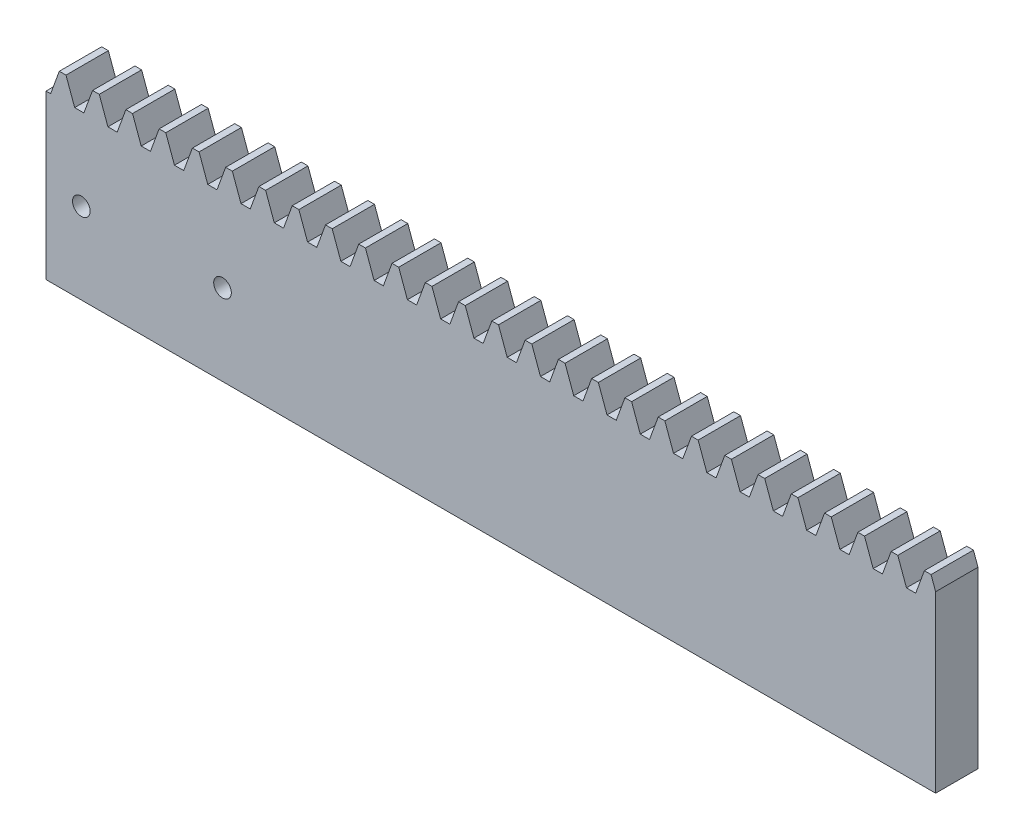
from build123d import *

# Parameters (mm, degrees)
BLANKSKE_W              = 126
BLANKSKE_H              = 26.5
BLANK_DEPTH             = 6
TOOTHCUTSIM_DEPTH       = 129.896276129
TEETHCUTS_COUNT         = 33
TEETHCUTS_PITCH         = 4.712388975
ESQUISSE1_R             = 1.25
ENL_V_MAT_EXTRU_1_DEPTH = 6


with BuildPart() as part:
    # BlankSke → Blank (new body)
    with BuildSketch(Plane.XY):
        with Locations((63, 13.25)):
            Rectangle(BLANKSKE_W, BLANKSKE_H)
    extrude(amount=-BLANK_DEPTH)

    # TooCutSkeSim → ToothCutSim (cut, through all)
    with BuildSketch(Plane.XY):
        Polygon((0.654653055, 23.125), (-0.654653055, 23.125), (-1.892297439, 26.5254), (1.892297439, 26.5254), align=None)
    toothcutsim = extrude(amount=-TOOTHCUTSIM_DEPTH, mode=Mode.SUBTRACT)

    # TeethCuts: ToothCutSim ×33
    with Locations(*[(i * TEETHCUTS_PITCH, 0, 0) for i in range(1, TEETHCUTS_COUNT)]):
        add(toothcutsim, mode=Mode.SUBTRACT)

    # Esquisse1 → Enlèv. mat.-Extru.1 (cut)
    with BuildSketch(Plane.XY):
        with Locations((5, 11.5)):
            Circle(ESQUISSE1_R)
        with Locations((25, 11.5)):
            Circle(ESQUISSE1_R)
    extrude(amount=-ENL_V_MAT_EXTRU_1_DEPTH, mode=Mode.SUBTRACT)


solid = part.part
